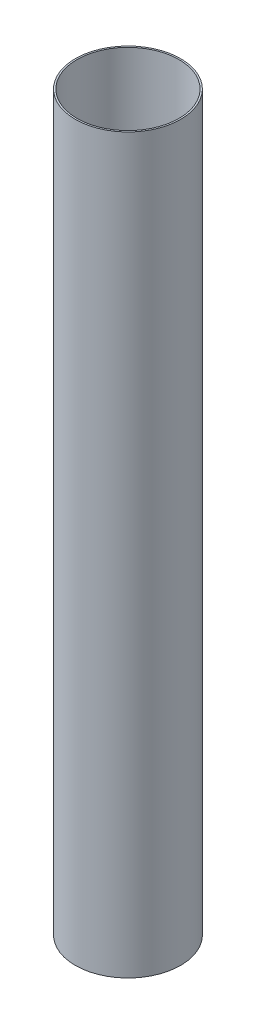
from build123d import *

# Parameters (mm, degrees)
SKETCH1_3_R            = 51.1048
SKETCH1_3_R_2          = 49.53
MOTOR_MOUNT_REV3_DEPTH = 711.2


with BuildPart() as part:
    # Sketch1<3> → Motor Mount Rev3 (new body)
    with BuildSketch(Plane(origin=(0, 0, 0), x_dir=(1, 0, 0), z_dir=(0, 1, 0))):
        Circle(SKETCH1_3_R)
        Circle(SKETCH1_3_R_2, mode=Mode.SUBTRACT)
    extrude(amount=MOTOR_MOUNT_REV3_DEPTH)


solid = part.part
